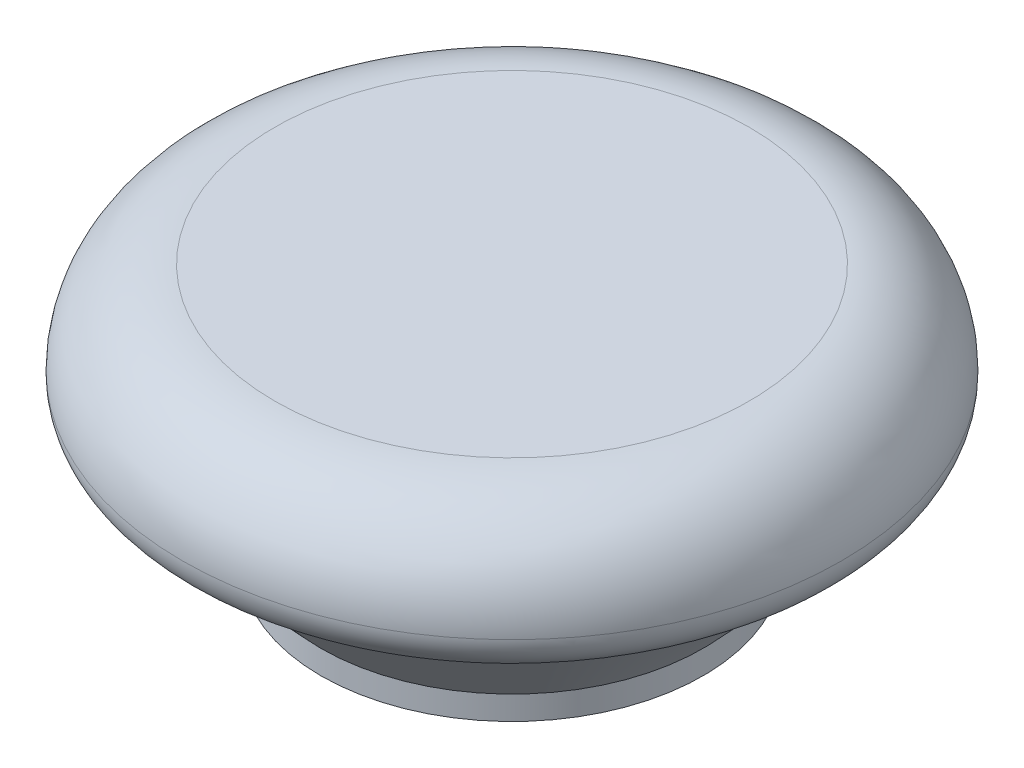
from build123d import *

# Parameters (mm, degrees)
SKETCH1_R           = 3
SKETCH2_R           = 7
SKETCH3_R           = 2
CUT_EXTRUDE1_DEPTH  = 8
FILLET1_R           = 0.45
FILLET2_R           = 0.4
SKETCH4_R           = 14.5
BOSS_EXTRUDE1_DEPTH = 1.8
SKETCH5_R           = 25
BOSS_EXTRUDE2_DEPTH = 3
FILLET3_R           = 3
SKETCH7_R           = 14.5
SKETCH6_R           = 22
SKETCH8_R           = 25
BOSS_EXTRUDE3_DEPTH = 7
FILLET4_R           = 7


with BuildPart() as part:
    # Sketch1 → Loft1 section 0
    with BuildSketch(Plane(origin=(0, 0, 0), x_dir=(1, 0, 0), z_dir=(0, 1, 0))):
        Circle(SKETCH1_R)
    # Sketch2 → Loft1 section 1
    with BuildSketch(Plane(origin=(0, 8, 0), x_dir=(1, 0, 0), z_dir=(0, 1, 0))):
        Circle(SKETCH2_R)
    loft()

    # Sketch3 → Cut-Extrude1 (cut)
    with BuildSketch(Plane.XZ):
        with Locations(Location((0, 0, 0), (0, 0, 270))):
            Circle(SKETCH3_R)
    extrude(amount=-CUT_EXTRUDE1_DEPTH, mode=Mode.SUBTRACT)

    # Fillet1
    fillet1_edges = [part.edges().sort_by_distance(p)[0] for p in [
        (-3, 0, 0),
    ]]
    fillet(fillet1_edges, radius=FILLET1_R)

    # Fillet2
    fillet2_edges = [part.edges().sort_by_distance(p)[0] for p in [
        (0, 0, 2),
    ]]
    fillet(fillet2_edges, radius=FILLET2_R)

    # Sketch4 → Boss-Extrude1 (add)
    with BuildSketch(Plane(origin=(0, 8, 0), x_dir=(1, 0, 0), z_dir=(0, 1, 0))):
        with Locations(Location((0, 0, 0), (0, 0, 270))):
            Circle(SKETCH4_R)
    extrude(amount=BOSS_EXTRUDE1_DEPTH)



with BuildPart() as body_2:
    # Sketch5 → Boss-Extrude2 (new body)
    with BuildSketch(Plane(origin=(0, 17.8, 0), x_dir=(1, 0, 0), z_dir=(0, 1, 0))):
        with Locations(Location((0, 0, 0), (0, 0, 270))):
            Circle(SKETCH5_R)
    extrude(amount=BOSS_EXTRUDE2_DEPTH)

    # Fillet3
    fillet3_edges = [body_2.edges().sort_by_distance(p)[0] for p in [
        (0, 17.8, -25),
    ]]
    fillet(fillet3_edges, radius=FILLET3_R - 0.0001)  # a hair under: the kernel refuses the full size


with BuildPart() as part_1:
    add(part.part)

    add(body_2.part)  # Loft3 merges body 2
    # Sketch7 → Loft3 section 0
    with BuildSketch(Plane(origin=(0, 9.8, 0), x_dir=(1, 0, 0), z_dir=(0, 1, 0))):
        Circle(SKETCH7_R)
    # Sketch6 → Loft3 section 1
    with BuildSketch(Plane.XZ.offset(-17.8)):
        Circle(SKETCH6_R)
    loft()

    # Sketch8 → Boss-Extrude3 (add)
    with BuildSketch(Plane(origin=(0, 20.8, 0), x_dir=(1, 0, 0), z_dir=(0, 1, 0))):
        with Locations(Location((0, 0, 0), (0, 0, 270))):
            Circle(SKETCH8_R)
    extrude(amount=BOSS_EXTRUDE3_DEPTH)

    # Fillet4
    fillet4_edges = [part_1.edges().sort_by_distance(p)[0] for p in [
        (0, 27.8, -25),
    ]]
    fillet(fillet4_edges, radius=FILLET4_R)


solid = part_1.part
